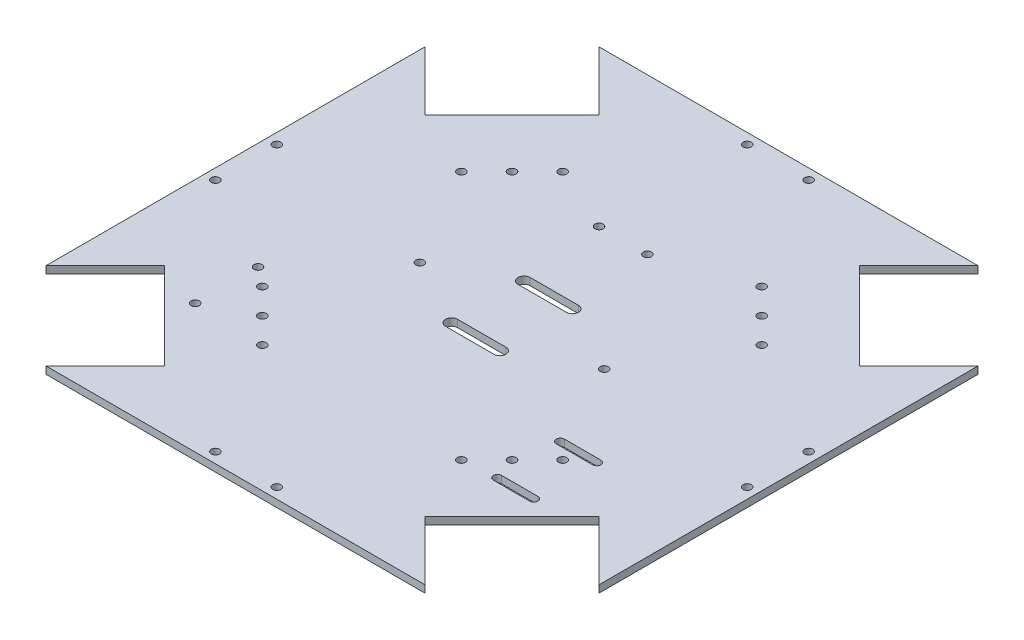
from build123d import *

# Parameters (mm, degrees)
SKETCH1_W                                   = 228.6
SKETCH1_H                                   = 228.6
PLATE_DEPTH                                 = 3
SKETCH8_R                                   = 1.7
MOTOR_MOUNT_HOLES_DEPTH                     = 3
SKETCH9_R                                   = 1.7
CONNECTOR_BOARD_HOLES_DEPTH                 = 3
MOTOR_CONTROLLER_HOLDER_ARDUINO_HOLES_REACH = 163.672
SKETCH11_R                                  = 1.7
CABLE_SLOTS_REACH                           = 163.672
WALL_BRACKET_HOLES_REACH                    = 163.672
SKETCH13_R                                  = 1.7
BATTERY_HOLDER_HOLES_REACH                  = 163.672
SKETCH14_R                                  = 1.7
WHEEL_SLOTS_DEPTH                           = 3


with BuildPart() as part:
    # Sketch1 → plate (new body)
    with BuildSketch(Plane(origin=(0, 0, 0), x_dir=(1, 0, 0), z_dir=(0, 1, 0))):
        Rectangle(SKETCH1_W, SKETCH1_H)
    extrude(amount=PLATE_DEPTH)

    # Sketch8 → motor-mount-holes (cut)
    with BuildSketch(Plane(origin=(0, 3, 0), x_dir=(1, 0, 0), z_dir=(0, 1, 0))):
        with Locations((51.618795027, 51.618795027)):
            Circle(SKETCH8_R)
        with Locations((62.083975388, 41.153614665)):
            Circle(SKETCH8_R)
        with Locations((41.153614665, 62.083975388)):
            Circle(SKETCH8_R)
        with Locations((51.618795027, -51.618795027)):
            Circle(SKETCH8_R)
        with Locations((62.083975388, -41.153614665)):
            Circle(SKETCH8_R)
        with Locations((41.153614665, -62.083975388)):
            Circle(SKETCH8_R)
        with Locations((-51.618795027, -51.618795027)):
            Circle(SKETCH8_R)
        with Locations((-41.153614665, -62.083975388)):
            Circle(SKETCH8_R)
        with Locations((-62.083975388, -41.153614665)):
            Circle(SKETCH8_R)
        with Locations((-51.618795027, 51.618795027)):
            Circle(SKETCH8_R)
        with Locations((-62.083975388, 41.153614665)):
            Circle(SKETCH8_R)
        with Locations((-41.153614665, 62.083975388)):
            Circle(SKETCH8_R)
    extrude(amount=-MOTOR_MOUNT_HOLES_DEPTH, mode=Mode.SUBTRACT)

    # Sketch9 → connector-board-holes (cut)
    with BuildSketch(Plane(origin=(0, 3, 0), x_dir=(1, 0, 0), z_dir=(0, 1, 0))):
        with Locations((-38.13, 0)):
            Circle(SKETCH9_R)
        with Locations((38.13, 0)):
            Circle(SKETCH9_R)
    extrude(amount=-CONNECTOR_BOARD_HOLES_DEPTH, mode=Mode.SUBTRACT)

    # Sketch11 → motor-controller-holder-arduino-holes (cut, up to next)
    with BuildSketch(Plane(origin=(0, 3, 0), x_dir=(1, 0, 0), z_dir=(0, 1, 0)), mode=Mode.PRIVATE) as motor_controller_holder_arduino_holes_sk1:
        with Locations((-14, 50)):
            Circle(SKETCH11_R)
    motor_controller_holder_arduino_holes_tool1 = extrude(motor_controller_holder_arduino_holes_sk1.sketch, amount=-MOTOR_CONTROLLER_HOLDER_ARDUINO_HOLES_REACH, mode=Mode.PRIVATE) & part.part
    # Sketch11 → motor-controller-holder-arduino-holes (cut, up to next)
    with BuildSketch(Plane(origin=(0, 3, 0), x_dir=(1, 0, 0), z_dir=(0, 1, 0)), mode=Mode.PRIVATE) as motor_controller_holder_arduino_holes_sk2:
        with Locations((6, 50)):
            Circle(SKETCH11_R)
    motor_controller_holder_arduino_holes_tool2 = extrude(motor_controller_holder_arduino_holes_sk2.sketch, amount=-MOTOR_CONTROLLER_HOLDER_ARDUINO_HOLES_REACH, mode=Mode.PRIVATE) & part.part
    add(motor_controller_holder_arduino_holes_tool1.solids().sort_by_distance((-14, 3, -50))[0], mode=Mode.SUBTRACT)
    add(motor_controller_holder_arduino_holes_tool2.solids().sort_by_distance((6, 3, -50))[0], mode=Mode.SUBTRACT)

    # Sketch12 → cable-slots (cut, up to next)
    with BuildSketch(Plane(origin=(0, 3, 0), x_dir=(1, 0, 0), z_dir=(0, 1, 0)), mode=Mode.PRIVATE) as cable_slots_sk1:
        with BuildLine():
            Line((-10, 17.5), (10, 17.5))
            ThreePointArc((10, 17.5), (12.5, 15), (10, 12.5))
            Line((10, 12.5), (-10, 12.5))
            ThreePointArc((-10, 12.5), (-12.5, 15), (-10, 17.5))
        make_face()
    cable_slots_tool1 = extrude(cable_slots_sk1.sketch, amount=-CABLE_SLOTS_REACH, mode=Mode.PRIVATE) & part.part
    # Sketch12 → cable-slots (cut, up to next)
    with BuildSketch(Plane(origin=(0, 3, 0), x_dir=(1, 0, 0), z_dir=(0, 1, 0)), mode=Mode.PRIVATE) as cable_slots_sk2:
        with BuildLine():
            Line((-10, -12.5), (10, -12.5))
            ThreePointArc((10, -12.5), (12.5, -15), (10, -17.5))
            Line((10, -17.5), (-10, -17.5))
            ThreePointArc((-10, -17.5), (-12.5, -15), (-10, -12.5))
        make_face()
    cable_slots_tool2 = extrude(cable_slots_sk2.sketch, amount=-CABLE_SLOTS_REACH, mode=Mode.PRIVATE) & part.part
    add(cable_slots_tool1.solids().sort_by_distance((0, 3, -15))[0], mode=Mode.SUBTRACT)
    add(cable_slots_tool2.solids().sort_by_distance((0, 3, 15))[0], mode=Mode.SUBTRACT)

    # Sketch13 → wall-bracket-holes (cut, up to next)
    with BuildSketch(Plane(origin=(0, 3, 0), x_dir=(1, 0, 0), z_dir=(0, 1, 0)), mode=Mode.PRIVATE) as wall_bracket_holes_sk1:
        with Locations((-12.7, 109.9439)):
            Circle(SKETCH13_R)
    wall_bracket_holes_tool1 = extrude(wall_bracket_holes_sk1.sketch, amount=-WALL_BRACKET_HOLES_REACH, mode=Mode.PRIVATE) & part.part
    # Sketch13 → wall-bracket-holes (cut, up to next)
    with BuildSketch(Plane(origin=(0, 3, 0), x_dir=(1, 0, 0), z_dir=(0, 1, 0)), mode=Mode.PRIVATE) as wall_bracket_holes_sk2:
        with Locations((12.7, 109.9439)):
            Circle(SKETCH13_R)
    wall_bracket_holes_tool2 = extrude(wall_bracket_holes_sk2.sketch, amount=-WALL_BRACKET_HOLES_REACH, mode=Mode.PRIVATE) & part.part
    # Sketch13 → wall-bracket-holes (cut, up to next)
    with BuildSketch(Plane(origin=(0, 3, 0), x_dir=(1, 0, 0), z_dir=(0, 1, 0)), mode=Mode.PRIVATE) as wall_bracket_holes_sk3:
        with Locations((109.9439, -12.7)):
            Circle(SKETCH13_R)
    wall_bracket_holes_tool3 = extrude(wall_bracket_holes_sk3.sketch, amount=-WALL_BRACKET_HOLES_REACH, mode=Mode.PRIVATE) & part.part
    # Sketch13 → wall-bracket-holes (cut, up to next)
    with BuildSketch(Plane(origin=(0, 3, 0), x_dir=(1, 0, 0), z_dir=(0, 1, 0)), mode=Mode.PRIVATE) as wall_bracket_holes_sk4:
        with Locations((109.9439, 12.7)):
            Circle(SKETCH13_R)
    wall_bracket_holes_tool4 = extrude(wall_bracket_holes_sk4.sketch, amount=-WALL_BRACKET_HOLES_REACH, mode=Mode.PRIVATE) & part.part
    # Sketch13 → wall-bracket-holes (cut, up to next)
    with BuildSketch(Plane(origin=(0, 3, 0), x_dir=(1, 0, 0), z_dir=(0, 1, 0)), mode=Mode.PRIVATE) as wall_bracket_holes_sk5:
        with Locations((-12.7, -109.9439)):
            Circle(SKETCH13_R)
    wall_bracket_holes_tool5 = extrude(wall_bracket_holes_sk5.sketch, amount=-WALL_BRACKET_HOLES_REACH, mode=Mode.PRIVATE) & part.part
    # Sketch13 → wall-bracket-holes (cut, up to next)
    with BuildSketch(Plane(origin=(0, 3, 0), x_dir=(1, 0, 0), z_dir=(0, 1, 0)), mode=Mode.PRIVATE) as wall_bracket_holes_sk6:
        with Locations((12.7, -109.9439)):
            Circle(SKETCH13_R)
    wall_bracket_holes_tool6 = extrude(wall_bracket_holes_sk6.sketch, amount=-WALL_BRACKET_HOLES_REACH, mode=Mode.PRIVATE) & part.part
    # Sketch13 → wall-bracket-holes (cut, up to next)
    with BuildSketch(Plane(origin=(0, 3, 0), x_dir=(1, 0, 0), z_dir=(0, 1, 0)), mode=Mode.PRIVATE) as wall_bracket_holes_sk7:
        with Locations((-109.9439, 12.7)):
            Circle(SKETCH13_R)
    wall_bracket_holes_tool7 = extrude(wall_bracket_holes_sk7.sketch, amount=-WALL_BRACKET_HOLES_REACH, mode=Mode.PRIVATE) & part.part
    # Sketch13 → wall-bracket-holes (cut, up to next)
    with BuildSketch(Plane(origin=(0, 3, 0), x_dir=(1, 0, 0), z_dir=(0, 1, 0)), mode=Mode.PRIVATE) as wall_bracket_holes_sk8:
        with Locations((-109.9439, -12.7)):
            Circle(SKETCH13_R)
    wall_bracket_holes_tool8 = extrude(wall_bracket_holes_sk8.sketch, amount=-WALL_BRACKET_HOLES_REACH, mode=Mode.PRIVATE) & part.part
    add(wall_bracket_holes_tool1.solids().sort_by_distance((-12.7, 3, -109.9439))[0], mode=Mode.SUBTRACT)
    add(wall_bracket_holes_tool2.solids().sort_by_distance((12.7, 3, -109.9439))[0], mode=Mode.SUBTRACT)
    add(wall_bracket_holes_tool3.solids().sort_by_distance((109.9439, 3, 12.7))[0], mode=Mode.SUBTRACT)
    add(wall_bracket_holes_tool4.solids().sort_by_distance((109.9439, 3, -12.7))[0], mode=Mode.SUBTRACT)
    add(wall_bracket_holes_tool5.solids().sort_by_distance((-12.7, 3, 109.9439))[0], mode=Mode.SUBTRACT)
    add(wall_bracket_holes_tool6.solids().sort_by_distance((12.7, 3, 109.9439))[0], mode=Mode.SUBTRACT)
    add(wall_bracket_holes_tool7.solids().sort_by_distance((-109.9439, 3, -12.7))[0], mode=Mode.SUBTRACT)
    add(wall_bracket_holes_tool8.solids().sort_by_distance((-109.9439, 3, 12.7))[0], mode=Mode.SUBTRACT)

    # Sketch14 → battery-holder-holes (cut, up to next)
    with BuildSketch(Plane(origin=(0, 3, 0), x_dir=(1, 0, 0), z_dir=(0, 1, 0)), mode=Mode.PRIVATE) as battery_holder_holes_sk1:
        with Locations((-70, -35)):
            Circle(SKETCH14_R)
    battery_holder_holes_tool1 = extrude(battery_holder_holes_sk1.sketch, amount=-BATTERY_HOLDER_HOLES_REACH, mode=Mode.PRIVATE) & part.part
    # Sketch14 → battery-holder-holes (cut, up to next)
    with BuildSketch(Plane(origin=(0, 3, 0), x_dir=(1, 0, 0), z_dir=(0, 1, 0)), mode=Mode.PRIVATE) as battery_holder_holes_sk2:
        with Locations((-70, -61)):
            Circle(SKETCH14_R)
    battery_holder_holes_tool2 = extrude(battery_holder_holes_sk2.sketch, amount=-BATTERY_HOLDER_HOLES_REACH, mode=Mode.PRIVATE) & part.part
    # Sketch14 → battery-holder-holes (cut, up to next)
    with BuildSketch(Plane(origin=(0, 3, 0), x_dir=(1, 0, 0), z_dir=(0, 1, 0)), mode=Mode.PRIVATE) as battery_holder_holes_sk3:
        with BuildLine():
            Line((55, -33.3), (70, -33.3))
            ThreePointArc((70, -33.3), (71.7, -35), (70, -36.7))
            Line((70, -36.7), (55, -36.7))
            ThreePointArc((55, -36.7), (53.3, -35), (55, -33.3))
        make_face()
    battery_holder_holes_tool3 = extrude(battery_holder_holes_sk3.sketch, amount=-BATTERY_HOLDER_HOLES_REACH, mode=Mode.PRIVATE) & part.part
    # Sketch14 → battery-holder-holes (cut, up to next)
    with BuildSketch(Plane(origin=(0, 3, 0), x_dir=(1, 0, 0), z_dir=(0, 1, 0)), mode=Mode.PRIVATE) as battery_holder_holes_sk4:
        with BuildLine():
            Line((55, -59.3), (70, -59.3))
            ThreePointArc((70, -59.3), (71.7, -61), (70, -62.7))
            Line((70, -62.7), (55, -62.7))
            ThreePointArc((55, -62.7), (53.3, -61), (55, -59.3))
        make_face()
    battery_holder_holes_tool4 = extrude(battery_holder_holes_sk4.sketch, amount=-BATTERY_HOLDER_HOLES_REACH, mode=Mode.PRIVATE) & part.part
    add(battery_holder_holes_tool1.solids().sort_by_distance((-70, 3, 35))[0], mode=Mode.SUBTRACT)
    add(battery_holder_holes_tool2.solids().sort_by_distance((-70, 3, 61))[0], mode=Mode.SUBTRACT)
    add(battery_holder_holes_tool3.solids().sort_by_distance((62.5, 3, 35))[0], mode=Mode.SUBTRACT)
    add(battery_holder_holes_tool4.solids().sort_by_distance((62.5, 3, 61))[0], mode=Mode.SUBTRACT)

    # Sketch2 → wheel-slots (cut)
    with BuildSketch(Plane(origin=(0, 3, 0), x_dir=(1, 0, 0), z_dir=(0, 1, 0))):
        Polygon((114.3, 114.3), (78.378975516, 114.3), (53.881536726, 89.802561211), (89.802561211, 53.881536726), (114.3, 78.378975516), align=None)
        Polygon((78.378975516, -114.3), (114.3, -114.3), (114.3, -78.378975516), (89.802561211, -53.881536726), (53.881536726, -89.802561211), align=None)
        Polygon((-114.3, -78.378975516), (-114.3, -114.3), (-78.378975516, -114.3), (-53.881536726, -89.802561211), (-89.802561211, -53.881536726), align=None)
        Polygon((-78.378975516, 114.3), (-114.3, 114.3), (-114.3, 78.378975516), (-89.802561211, 53.881536726), (-53.881536726, 89.802561211), align=None)
    extrude(amount=-WHEEL_SLOTS_DEPTH, mode=Mode.SUBTRACT)


solid = part.part
